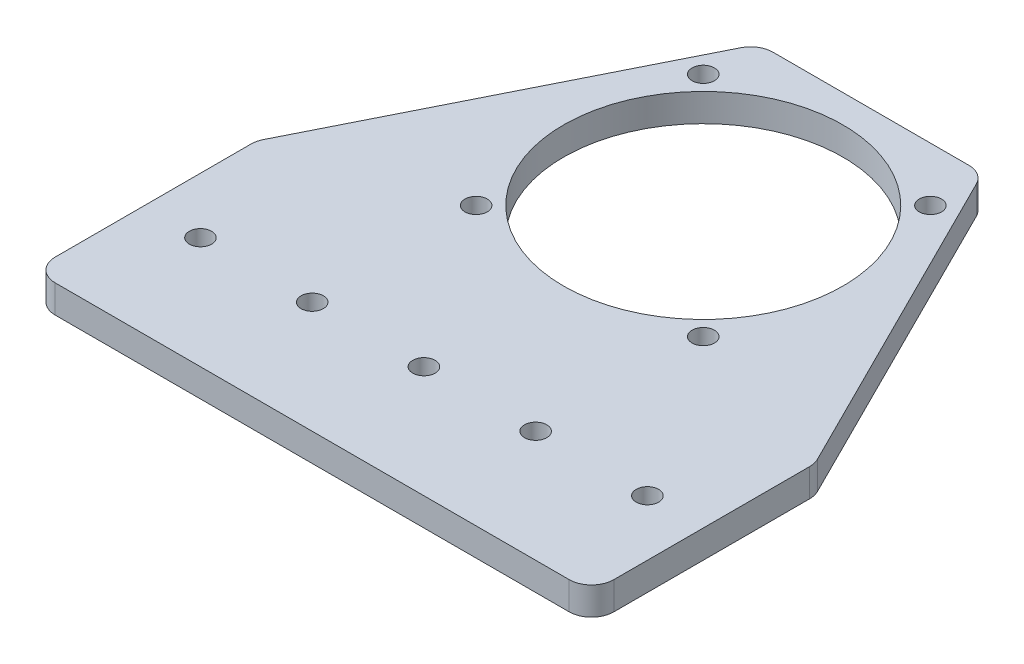
from build123d import *

# Parameters (mm, degrees)
SKETCH1_R             = 15.875
SKETCH1_R_2           = 1.27
INITIAL_BRACKET_DEPTH = 3.175
EDGE_FILLET_R         = 2.54
LPATTERN1_OUTLINE_R   = 1.27
LPATTERN1_DEPTH       = 3.175


# Read off the part's stored shape, not the designer's step: LPattern1
with BuildPart() as part:
    # Sketch1 → Initial Bracket (new body)
    with BuildSketch(Plane(origin=(0, 0, 0), x_dir=(1, 0, 0), z_dir=(0, 1, 0))):
        Polygon((-31.75, -31.75), (31.75, -31.75), (31.75, -6.35), (12.7, 31.75), (-12.7, 31.75), (-31.75, -6.35), align=None)
        with Locations(Location((0, 12.7, 0), (0, 0, 270))):
            Circle(SKETCH1_R, mode=Mode.SUBTRACT)
        with Locations(Location((12.909118174, 25.609118174, 0), (0, 0, 270))):
            Circle(SKETCH1_R_2, mode=Mode.SUBTRACT)
        with Locations(Location((12.909118174, -0.209118174, 0), (0, 0, 270))):
            Circle(SKETCH1_R_2, mode=Mode.SUBTRACT)
        with Locations(Location((-12.909118174, -0.209118174, 0), (0, 0, 270))):
            Circle(SKETCH1_R_2, mode=Mode.SUBTRACT)
        with Locations(Location((-12.909118174, 25.609118174, 0), (0, 0, 270))):
            Circle(SKETCH1_R_2, mode=Mode.SUBTRACT)
        with Locations(Location((-25.4, -19.05, 0), (0, 0, 270))):
            Circle(SKETCH1_R_2, mode=Mode.SUBTRACT)
    extrude(amount=INITIAL_BRACKET_DEPTH)

    # Edge Fillet
    edge_fillet_edges = [part.edges().sort_by_distance(p)[0] for p in [
        (31.75, 1.5875, 31.75),
        (-31.75, 1.5875, 31.75),
        (-31.75, 1.5875, 6.35),
        (-12.7, 1.5875, -31.75),
        (12.7, 1.5875, -31.75),
        (31.75, 1.5875, 6.35),
    ]]
    fillet(edge_fillet_edges, radius=EDGE_FILLET_R)

    # LPattern1 outline → LPattern1 (cut)
    with BuildSketch(Plane(origin=(0, 0, 0), x_dir=(1, 0, 0), z_dir=(0, 1, 0))):
        with Locations((25.4, -19.05)):
            Circle(LPATTERN1_OUTLINE_R)
        with Locations((12.7, -19.05)):
            Circle(LPATTERN1_OUTLINE_R)
        with Locations((0, -19.05)):
            Circle(LPATTERN1_OUTLINE_R)
        with Locations((-12.7, -19.05)):
            Circle(LPATTERN1_OUTLINE_R)
    extrude(amount=LPATTERN1_DEPTH, mode=Mode.SUBTRACT)


solid = part.part
